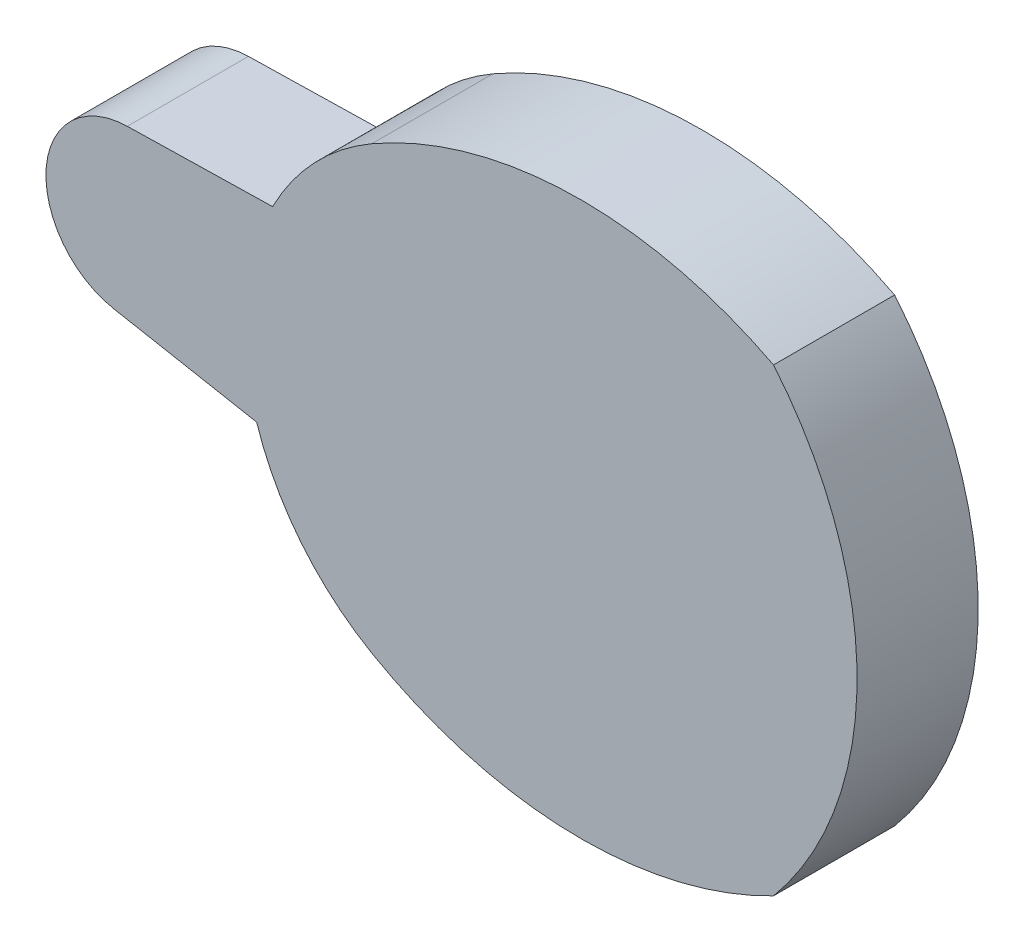
from build123d import *

# Parameters (mm, degrees)
BOSS_EXTRUDE1_DEPTH = 3.800000096
BOSS_EXTRUDE2_DEPTH = 2


with BuildPart() as part:
    # Sketch7 → Boss-Extrude1 (new body)
    with BuildSketch(Plane.XY):
        with BuildLine():
            ThreePointArc((-33.515331309, 5.433002286), (-37.398650401, 1.777981375), (-34.162442321, -2.460686138))
            Line((-34.162442321, -2.460686138), (-27.319744353, -3.740057236))
            ThreePointArc((-27.319744353, -3.740057236), (-25.198740105, -7.664015147), (-21.808759445, -10.563003905))
            ThreePointArc((-21.808759445, -10.563003905), (-12.24514023, -13.245034669), (-2.567249995, -11.010187448))
            ThreePointArc((-2.567249995, -11.010187448), (1.4351, 0), (-2.567249995, 11.010187448))
            ThreePointArc((-2.567249995, 11.010187448), (-12.24514023, 13.245034669), (-21.808759445, 10.563003905))
            ThreePointArc((-21.808759445, 10.563003905), (-24.540834155, 8.413644492), (-26.555630229, 5.58087643))
            Line((-26.555630229, 5.58087643), (-33.515331309, 5.433002286))
        make_face()
        with BuildLine():
            Line((-27.37529807, 3.563009393), (-15.791139853, 3.809140291))
            ThreePointArc((-15.791139853, 3.809140291), (-11.912944563, -0.311292991), (-16.410423725, -3.745102876))
            Line((-16.410423725, -3.745102876), (-27.799834704, -1.615638256))
            Line((-27.799834704, -1.615638256), (-33.794874116, -0.49475287))
            ThreePointArc((-33.794874116, -0.49475287), (-35.405337155, 1.614572981), (-33.472846503, 3.433453577))
            Line((-33.472846503, 3.433453577), (-27.37529807, 3.563009393))
        make_face(mode=Mode.SUBTRACT)
    extrude(amount=BOSS_EXTRUDE1_DEPTH)

    # Sketch8 → Boss-Extrude2 (add)
    with BuildSketch(Plane.XY.offset(3.800000096)):
        with BuildLine():
            Line((-26.555630229, 5.58087643), (-33.515331309, 5.433002286))
            ThreePointArc((-33.515331309, 5.433002286), (-37.398650401, 1.777981375), (-34.162442321, -2.460686138))
            Line((-34.162442321, -2.460686138), (-27.319744353, -3.740057236))
            ThreePointArc((-27.319744353, -3.740057236), (-25.198740105, -7.664015147), (-21.808759445, -10.563003905))
            ThreePointArc((-21.808759445, -10.563003905), (-12.24514023, -13.245034669), (-2.567249995, -11.010187448))
            ThreePointArc((-2.567249995, -11.010187448), (1.4351, 0), (-2.567249995, 11.010187448))
            ThreePointArc((-2.567249995, 11.010187448), (-12.24514023, 13.245034669), (-21.808759445, 10.563003905))
            ThreePointArc((-21.808759445, 10.563003905), (-24.540834155, 8.413644492), (-26.555630229, 5.58087643))
        make_face()
    extrude(amount=BOSS_EXTRUDE2_DEPTH)


solid = part.part
